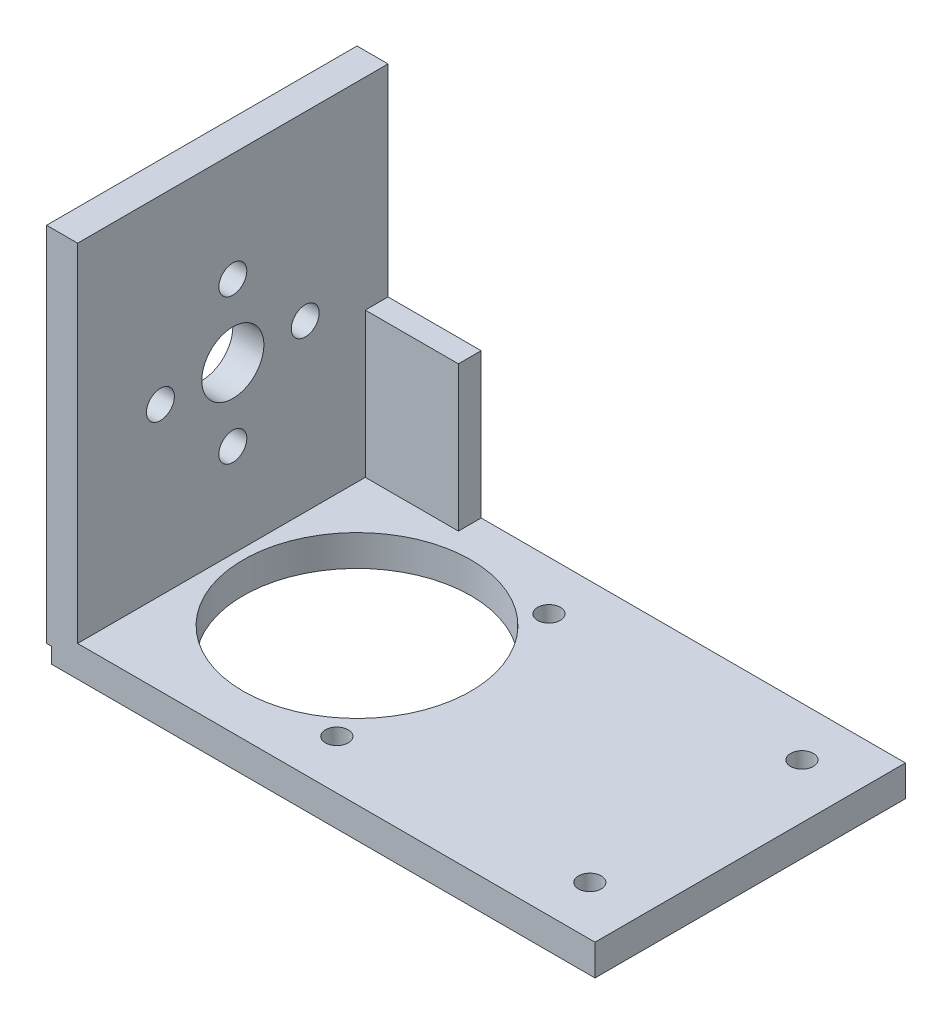
from build123d import *

# Parameters (mm, degrees)
S_BOX1_W      = 3
S_BOX1_H      = 35
BOSS_1_DEPTH  = 30
S_BOX2_W      = 52.5
S_BOX2_H      = 3
BOSS_2_DEPTH  = 30
S_BOX3_W      = 11.5
S_BOX3_H      = 16.5
BOSS_3_DEPTH  = 2.2
S_HOLE4_R     = 3
HOLE_4_DEPTH  = 3.2
S_HOLE5_R     = 1.35
HOLE_5_DEPTH  = 3.2
S_HOLE6_R     = 1.35
HOLE_6_DEPTH  = 3.2
S_HOLE7_R     = 1.35
HOLE_7_DEPTH  = 3.2
S_HOLE8_R     = 1.35
HOLE_8_DEPTH  = 3.2
S_HOLE9_R     = 11
HOLE_9_DEPTH  = 3.2
S_HOLE10_R    = 1.1
HOLE_10_DEPTH = 3.2
S_HOLE11_R    = 1.1
HOLE_11_DEPTH = 3.2
S_HOLE12_R    = 1.1
HOLE_12_DEPTH = 3.2
S_HOLE13_R    = 1.1
HOLE_13_DEPTH = 3.2


with BuildPart() as part:
    # S_box1 → Boss_1 (new body)
    with BuildSketch(Plane.XY.offset(-15)):
        with Locations((-13.5, 0)):
            Rectangle(S_BOX1_W, S_BOX1_H)
    extrude(amount=BOSS_1_DEPTH)

    # S_box2 → Boss_2 (add)
    with BuildSketch(Plane.XY.offset(-15)):
        with Locations((11.75, -17.5)):
            Rectangle(S_BOX2_W, S_BOX2_H)
    extrude(amount=BOSS_2_DEPTH)

    # S_box3 → Boss_3 (add)
    with BuildSketch(Plane.XY.offset(-15)):
        with Locations((-8.75, -10.25)):
            Rectangle(S_BOX3_W, S_BOX3_H)
    extrude(amount=BOSS_3_DEPTH)

    # S_hole4 → Hole_4 (cut)
    with BuildSketch(Plane(origin=(-15.1, 0, 0), x_dir=(0, 0, -1), z_dir=(1, 0, 0))):
        Circle(S_HOLE4_R)
    extrude(amount=HOLE_4_DEPTH, mode=Mode.SUBTRACT)

    # S_hole5 → Hole_5 (cut)
    with BuildSketch(Plane(origin=(-15.1, 0, 0), x_dir=(0, 0, -1), z_dir=(1, 0, 0))):
        with Locations((0, 7)):
            Circle(S_HOLE5_R)
    extrude(amount=HOLE_5_DEPTH, mode=Mode.SUBTRACT)

    # S_hole6 → Hole_6 (cut)
    with BuildSketch(Plane(origin=(-15.1, 0, 0), x_dir=(0, 0, -1), z_dir=(1, 0, 0))):
        with Locations((-7, 0)):
            Circle(S_HOLE6_R)
    extrude(amount=HOLE_6_DEPTH, mode=Mode.SUBTRACT)

    # S_hole7 → Hole_7 (cut)
    with BuildSketch(Plane(origin=(-15.1, 0, 0), x_dir=(0, 0, -1), z_dir=(1, 0, 0))):
        with Locations((0, -7)):
            Circle(S_HOLE7_R)
    extrude(amount=HOLE_7_DEPTH, mode=Mode.SUBTRACT)

    # S_hole8 → Hole_8 (cut)
    with BuildSketch(Plane(origin=(-15.1, 0, 0), x_dir=(0, 0, -1), z_dir=(1, 0, 0))):
        with Locations((7, 0)):
            Circle(S_HOLE8_R)
    extrude(amount=HOLE_8_DEPTH, mode=Mode.SUBTRACT)

    # S_hole9 → Hole_9 (cut)
    with BuildSketch(Plane(origin=(0, -19.1, 0), x_dir=(1, 0, 0), z_dir=(0, 1, 0))):
        Circle(S_HOLE9_R)
    extrude(amount=HOLE_9_DEPTH, mode=Mode.SUBTRACT)

    # S_hole10 → Hole_10 (cut)
    with BuildSketch(Plane(origin=(0, -19.1, 0), x_dir=(1, 0, 0), z_dir=(0, 1, 0))):
        with Locations((8.3, 10.25)):
            Circle(S_HOLE10_R)
    extrude(amount=HOLE_10_DEPTH, mode=Mode.SUBTRACT)

    # S_hole11 → Hole_11 (cut)
    with BuildSketch(Plane(origin=(0, -19.1, 0), x_dir=(1, 0, 0), z_dir=(0, 1, 0))):
        with Locations((8.3, -10.25)):
            Circle(S_HOLE11_R)
    extrude(amount=HOLE_11_DEPTH, mode=Mode.SUBTRACT)

    # S_hole12 → Hole_12 (cut)
    with BuildSketch(Plane(origin=(0, -19.1, 0), x_dir=(1, 0, 0), z_dir=(0, 1, 0))):
        with Locations((32.75, 10.25)):
            Circle(S_HOLE12_R)
    extrude(amount=HOLE_12_DEPTH, mode=Mode.SUBTRACT)

    # S_hole13 → Hole_13 (cut)
    with BuildSketch(Plane(origin=(0, -19.1, 0), x_dir=(1, 0, 0), z_dir=(0, 1, 0))):
        with Locations((32.75, -10.25)):
            Circle(S_HOLE13_R)
    extrude(amount=HOLE_13_DEPTH, mode=Mode.SUBTRACT)


solid = part.part
